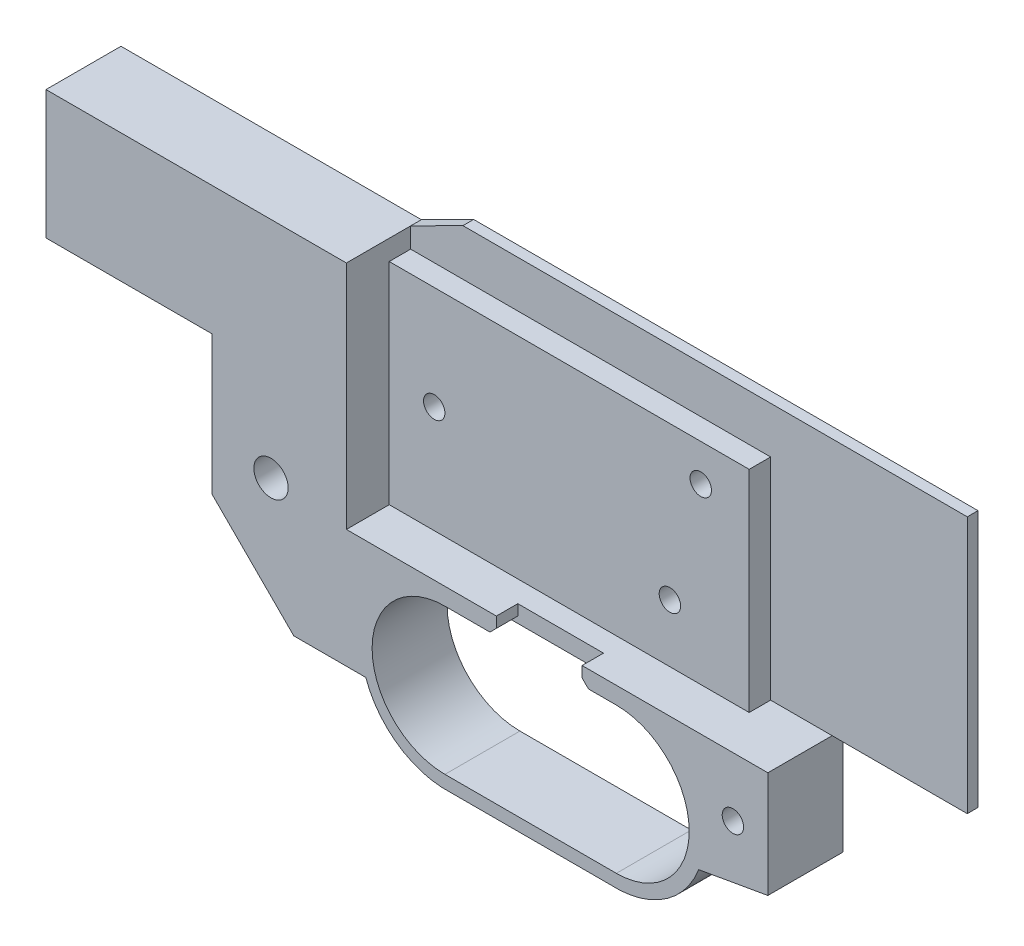
from build123d import *

# Parameters (mm, degrees)
EXTRUDE_1_DEPTH     = 2.5
EXTRUDE_2_DEPTH     = 17.5
CUT_EXTRUDE_2_REACH = 212.718
SKETCH_5_W          = 20
SKETCH_5_H          = 5
CHAMFER_1_SIZE      = 1.5
EXTRUDE_3_DEPTH     = 7.5
CUT_EXTRUDE_3_DEPTH = 3
SKETCH_13_R         = 2.5
CUT_EXTRUDE_4_DEPTH = 10
SKETCH_14_W         = 8
SKETCH_14_H         = 15
CUT_EXTRUDE_5_DEPTH = 3
CHAMFER_2_SIZE      = 1
CUT_EXTRUDE_6_REACH = 210.439
SKETCH_15_R         = 4
FILLET_1_R          = 1
CUT_EXTRUDE_7_REACH = 210.669
SKETCH_18_R         = 2.5


with BuildPart() as part:
    # 스케치2 → 보스-돌출1 (new body)
    with BuildSketch(Plane.XY):
        with BuildLine():
            Line((70.1, 38), (0, 38))
            Line((0, 38), (0, 8))
            Line((0, 8), (38.730142729, 8))
            Line((38.730142729, 8), (38.730142729, -24.4))
            Line((38.730142729, -24.4), (57.830142729, -43.5))
            Line((57.830142729, -43.5), (74.630142729, -43.5))
            ThreePointArc((74.630142729, -43.5), (81.464191763, -52.855667895), (92.338911336, -56.852319262))
            Line((92.338911336, -56.852319262), (131.588043415, -56.852319262))
            ThreePointArc((131.588043415, -56.852319262), (144.135794003, -53.569804808), (152.310142729, -43.5))
            Line((152.310142729, -43.5), (168.460142729, -40.652319262))
            Line((168.460142729, -40.652319262), (168.460142729, -15.852319262))
            Line((168.460142729, -15.852319262), (200, -15.852319262))
            Line((200, -15.852319262), (200, 44.147680738))
            Line((200, 44.147680738), (82.3, 44.147680738))
            Line((82.3, 44.147680738), (70.1, 38))
        make_face()
        with BuildLine():
            Line((93.10095722, -19.852319262), (133.10095722, -19.852319262))
            ThreePointArc((133.10095722, -19.852319262), (150.10095722, -36.852319262), (133.10095722, -53.852319262))
            Line((133.10095722, -53.852319262), (93.10095722, -53.852319262))
            ThreePointArc((93.10095722, -53.852319262), (76.10095722, -36.852319262), (93.10095722, -19.852319262))
        make_face(mode=Mode.SUBTRACT)
    extrude(amount=EXTRUDE_1_DEPTH)

    # 스케치2<3> → 보스-돌출2 (add)
    with BuildSketch(Plane.XY):
        with BuildLine():
            Line((70.1, 38), (0, 38))
            Line((0, 38), (0, 8))
            Line((0, 8), (38.730142729, 8))
            Line((38.730142729, 8), (38.730142729, -24.4))
            Line((38.730142729, -24.4), (57.830142729, -43.5))
            Line((57.830142729, -43.5), (74.630142729, -43.5))
            ThreePointArc((74.630142729, -43.5), (81.464191763, -52.855667895), (92.338911336, -56.852319262))
            Line((92.338911336, -56.852319262), (131.588043415, -56.852319262))
            ThreePointArc((131.588043415, -56.852319262), (144.135794003, -53.569804808), (152.310142729, -43.5))
            Line((152.310142729, -43.5), (168.460142729, -40.652319262))
            Line((168.460142729, -40.652319262), (168.460142729, -15.852319262))
            Line((168.460142729, -15.852319262), (70.10095722, -15.852319262))
            Line((70.10095722, -15.852319262), (70.1, 38))
        make_face()
        with BuildLine():
            Line((93.10095722, -19.852319262), (133.10095722, -19.852319262))
            ThreePointArc((133.10095722, -19.852319262), (150.10095722, -36.852319262), (133.10095722, -53.852319262))
            Line((133.10095722, -53.852319262), (93.10095722, -53.852319262))
            ThreePointArc((93.10095722, -53.852319262), (76.10095722, -36.852319262), (93.10095722, -19.852319262))
        make_face(mode=Mode.SUBTRACT)
    extrude(amount=EXTRUDE_2_DEPTH)

    # 스케치5 → 컷-돌출2 (cut, up to next)
    with BuildSketch(Plane.XZ.offset(19.852319262), mode=Mode.PRIVATE) as cut_extrude_2_sk1:
        with Locations((115.10095722, 15)):
            Rectangle(SKETCH_5_W, SKETCH_5_H)
    cut_extrude_2_tool1 = extrude(cut_extrude_2_sk1.sketch, amount=-CUT_EXTRUDE_2_REACH, mode=Mode.PRIVATE) & part.part
    add(cut_extrude_2_tool1.solids().sort_by_distance((115.100957, -19.852319, 15))[0], mode=Mode.SUBTRACT)

    # 모따기1
    chamfer_1_edges = [part.edges().sort_by_distance(p)[0] for p in [
        (125.10095722, -19.852319262, 15),
        (105.10095722, -19.852319262, 15),
    ]]
    chamfer(chamfer_1_edges, length=CHAMFER_1_SIZE)

    # 스케치2<4> → 보스-돌출3 (add)
    with BuildSketch(Plane.XY):
        Polygon((154.10095722, 33.295670157), (70.100083619, 33.295670157), (70.100462148, 12), (70.10095722, -15.852319262), (154.10095722, -15.852319262), align=None)
    extrude(amount=EXTRUDE_3_DEPTH)

    # 스케치2<5> → 컷-돌출3 (cut)
    with BuildSketch(Plane.XY):
        Polygon((66.230142729, 0), (38.730142729, 0), (38.730142729, -24.4), (57.830142729, -43.5), (66.230142729, -43.5), align=None)
    extrude(amount=CUT_EXTRUDE_3_DEPTH, mode=Mode.SUBTRACT)

    # 스케치13 → 컷-돌출4 (cut, symmetric)
    with BuildSketch(Plane.XY.offset(7.5)):
        with Locations((80.6, 9.15)):
            Circle(SKETCH_13_R)
        with Locations((135.59886794, -2.35)):
            Circle(SKETCH_13_R)
        with Locations((142.79886794, 24.65)):
            Circle(SKETCH_13_R)
    extrude(amount=CUT_EXTRUDE_4_DEPTH, both=True, mode=Mode.SUBTRACT)

    # 스케치14 → 컷-돌출5 (cut)
    with BuildSketch(Plane(origin=(0, 0, 3), x_dir=(-1, 0, 0), z_dir=(0, 0, -1))):
        with Locations((-62.230142729, -36)):
            Rectangle(SKETCH_14_W, SKETCH_14_H)
    extrude(amount=-CUT_EXTRUDE_5_DEPTH, mode=Mode.SUBTRACT)

    # 모따기2
    # the kernel refuses this chamfer: 1 mm, written as the material it takes off along each edge
    with BuildSketch(Plane(origin=(58.230142729, -43.5, 0.428317012), x_dir=(-0.9996219169112968, -0.027495876610589005, 0), z_dir=(0, 0, 1))) as chamfer_2_piece_1:
        Polygon((CHAMFER_2_SIZE * 0.999621916911, -CHAMFER_2_SIZE * 0.0274958766106), (-CHAMFER_2_SIZE * 0.0274958766106, -CHAMFER_2_SIZE * 0.999621916911), (0, 0), align=None)
    extrude(amount=5.571682988, mode=Mode.SUBTRACT)

    # 스케치15 → 컷-돌출6 (cut, up to next)
    with BuildSketch(Plane(origin=(0, 0, 3), x_dir=(-1, 0, 0), z_dir=(0, 0, -1)), mode=Mode.PRIVATE) as cut_extrude_6_sk1:
        with Locations((-52.505609521, -14.268427339)):
            Circle(SKETCH_15_R)
    cut_extrude_6_tool1 = extrude(cut_extrude_6_sk1.sketch, amount=-CUT_EXTRUDE_6_REACH, mode=Mode.PRIVATE) & part.part
    add(cut_extrude_6_tool1.solids().sort_by_distance((52.50561, -14.268427, 3))[0], mode=Mode.SUBTRACT)

    # 필렛1
    fillet_1_edges = [part.edges().sort_by_distance(p)[0] for p in [
        (56.505609521, -14.268427339, 3),
    ]]
    fillet(fillet_1_edges, radius=FILLET_1_R)

    # 스케치18 → 컷-돌출7 (cut, up to next)
    with BuildSketch(Plane(origin=(0, 0, 0), x_dir=(-1, 0, 0), z_dir=(0, 0, -1)), mode=Mode.PRIVATE) as cut_extrude_7_sk1:
        with Locations((-160.302780776, -29.676087823)):
            Circle(SKETCH_18_R)
    cut_extrude_7_tool1 = extrude(cut_extrude_7_sk1.sketch, amount=-CUT_EXTRUDE_7_REACH, mode=Mode.PRIVATE) & part.part
    add(cut_extrude_7_tool1.solids().sort_by_distance((160.302781, -29.676088, 0))[0], mode=Mode.SUBTRACT)


solid = part.part
